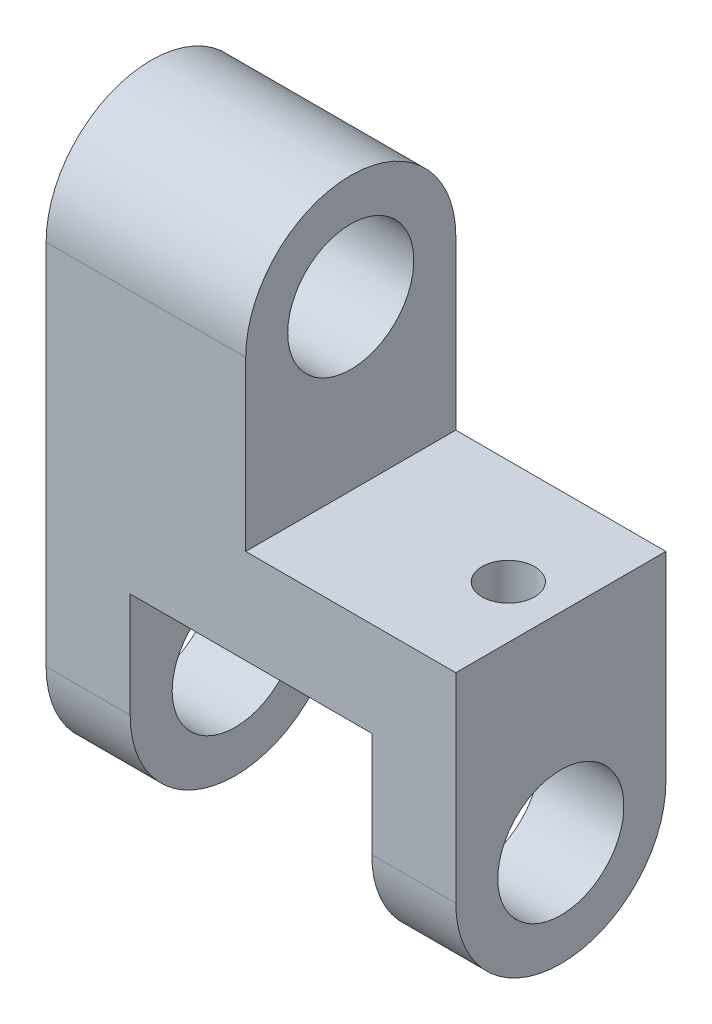
from build123d import *

# Parameters (mm, degrees)
SKETCH_1_R               = 6
EXTRUDE_1_DEPTH          = 39
CUT_EXTRUDE_1_DEPTH      = 49.757050772
CUT_EXTRUDE_1_DEPTH_BACK = 49.757050772
SKETCH_2_W               = 23
SKETCH_2_H               = 33.092407746
CUT_EXTRUDE_2_DEPTH      = 49.757050772
CUT_EXTRUDE_2_DEPTH_BACK = 49.757050772
SKETCH_3_W               = 43.713213687
SKETCH_3_H               = 33.597275916
SKETCH_4_R               = 2.5
CUT_EXTRUDE_3_DEPTH      = 10


with BuildPart() as part:
    # Эскиз1 → Бобышка-Вытянуть1 (new body)
    with BuildSketch(Plane(origin=(0, 0, 0), x_dir=(0, 0, -1), z_dir=(1, 0, 0))):
        with BuildLine():
            Line((10, 17.5), (10, -17.5))
            ThreePointArc((10, -17.5), (0, -27.5), (-10, -17.5))
            Line((-10, -17.5), (-10, 17.5))
            ThreePointArc((-10, 17.5), (0, 27.5), (10, 17.5))
        make_face()
        with Locations((0, 17.5)):
            Circle(SKETCH_1_R, mode=Mode.SUBTRACT)
        with Locations((0, -17.5)):
            Circle(SKETCH_1_R, mode=Mode.SUBTRACT)
    extrude(amount=EXTRUDE_1_DEPTH)

    # Эскиз2 → Вырез-Вытянуть1 (cut, two sides: drawn at the far end of the back side and taken through both)
    with BuildSketch(Plane.XY.offset(-CUT_EXTRUDE_1_DEPTH_BACK)):
        with Locations((19.5, -24.046203873)):
            Rectangle(SKETCH_2_W, SKETCH_2_H)
    extrude(amount=CUT_EXTRUDE_1_DEPTH + CUT_EXTRUDE_1_DEPTH_BACK, mode=Mode.SUBTRACT)

    # Эскиз3 → Вырез-Вытянуть2 (cut, two sides: drawn at the far end of the back side and taken through both)
    with BuildSketch(Plane.XY.offset(-CUT_EXTRUDE_2_DEPTH_BACK)):
        with Locations((40.856606844, 18.298637958)):
            Rectangle(SKETCH_3_W, SKETCH_3_H)
    extrude(amount=CUT_EXTRUDE_2_DEPTH + CUT_EXTRUDE_2_DEPTH_BACK, mode=Mode.SUBTRACT)

    # Эскиз4 → Вырез-Вытянуть3 (cut)
    with BuildSketch(Plane(origin=(0, 1.5, 0), x_dir=(1, 0, 0), z_dir=(0, 1, 0))):
        with Locations((34, 0)):
            Circle(SKETCH_4_R)
    extrude(amount=-CUT_EXTRUDE_3_DEPTH, mode=Mode.SUBTRACT)


solid = part.part
